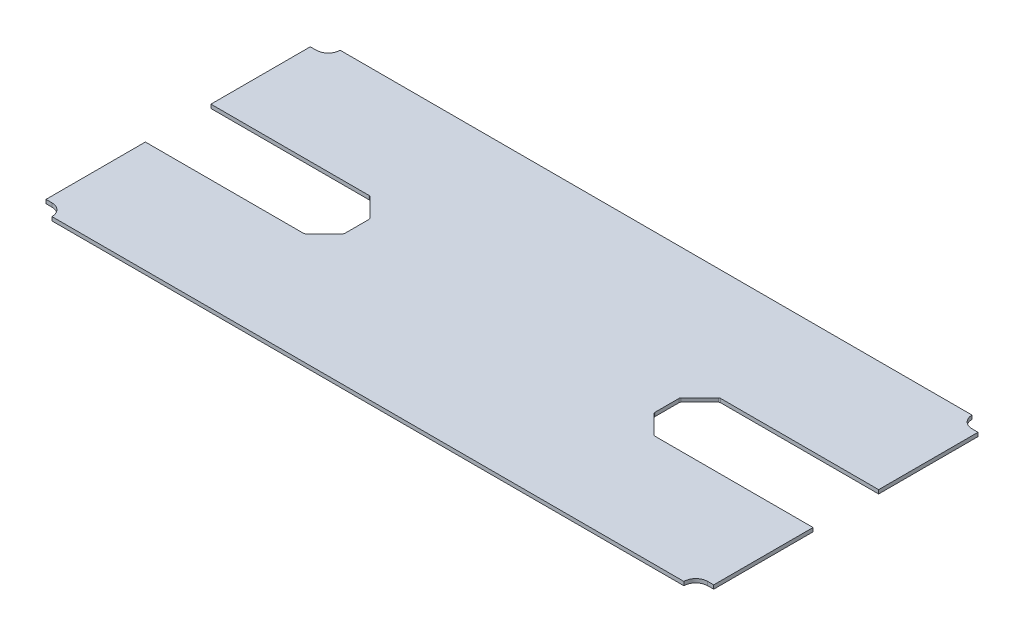
from build123d import *

# Parameters (mm, degrees)
BOSS_EXTRUDE1_DEPTH = 9.525
CHAMFER1_SIZE       = 50
FILLET2_R           = 5


with BuildPart() as part:
    # Sketch1 → Boss-Extrude1 (new body)
    with BuildSketch(Plane(origin=(0, 0, 0), x_dir=(1, 0, 0), z_dir=(0, 1, 0))):
        with BuildLine():
            Line((-840, 332.5), (-840, 82.5))
            Line((-840, 82.5), (-390, 82.5))
            Line((-390, 82.5), (-390, -82.5))
            Line((-390, -82.5), (-840, -82.5))
            Line((-840, -82.5), (-840, -332.5))
            Line((-840, -332.5), (-825, -332.5))
            ThreePointArc((-825, -332.5), (-803.786796564, -341.286796564), (-795, -362.5))
            Line((-795, -362.5), (795, -362.5))
            ThreePointArc((795, -362.5), (803.786796564, -341.286796564), (825, -332.5))
            Line((825, -332.5), (840, -332.5))
            Line((840, -332.5), (840, -82.5))
            Line((840, -82.5), (390, -82.5))
            Line((390, -82.5), (390, 82.5))
            Line((390, 82.5), (840, 82.5))
            Line((840, 82.5), (840, 332.5))
            Line((840, 332.5), (825, 332.5))
            ThreePointArc((825, 332.5), (803.786796564, 341.286796564), (795, 362.5))
            Line((795, 362.5), (-795, 362.5))
            ThreePointArc((-795, 362.5), (-803.786796564, 341.286796564), (-825, 332.5))
            Line((-825, 332.5), (-840, 332.5))
        make_face()
    extrude(amount=BOSS_EXTRUDE1_DEPTH)

    # Chamfer1
    chamfer1_edges = [part.edges().sort_by_distance(p)[0] for p in [
        (390, 4.7625, 82.5),
        (390, 4.7625, -82.5),
        (-390, 4.7625, 82.5),
        (-390, 4.7625, -82.5),
    ]]
    chamfer(chamfer1_edges, length=CHAMFER1_SIZE)

    # Fillet2
    fillet2_edges = [part.edges().sort_by_distance(p)[0] for p in [
        (390, 4.7625, -32.5),
        (390, 4.7625, 32.5),
        (440, 4.7625, 82.5),
        (440, 4.7625, -82.5),
        (-440, 4.7625, 82.5),
        (-390, 4.7625, 32.5),
        (-390, 4.7625, -32.5),
        (-440, 4.7625, -82.5),
    ]]
    fillet(fillet2_edges, radius=FILLET2_R)


solid = part.part
